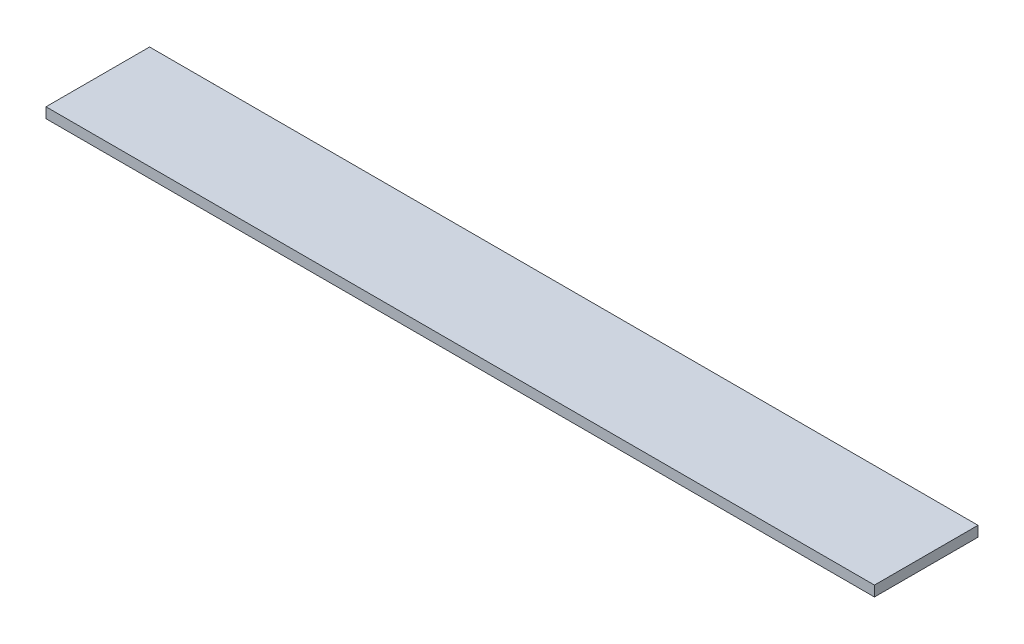
from build123d import *

# Parameters (mm, degrees)
SKETCH1_W           = 800
SKETCH1_H           = 100
BOSS_EXTRUDE1_DEPTH = 10


with BuildPart() as part:
    # Sketch1 → Boss-Extrude1 (new body)
    with BuildSketch(Plane(origin=(0, 0, 0), x_dir=(1, 0, 0), z_dir=(0, 1, 0))):
        Rectangle(SKETCH1_W, SKETCH1_H)
    extrude(amount=-BOSS_EXTRUDE1_DEPTH)


solid = part.part
